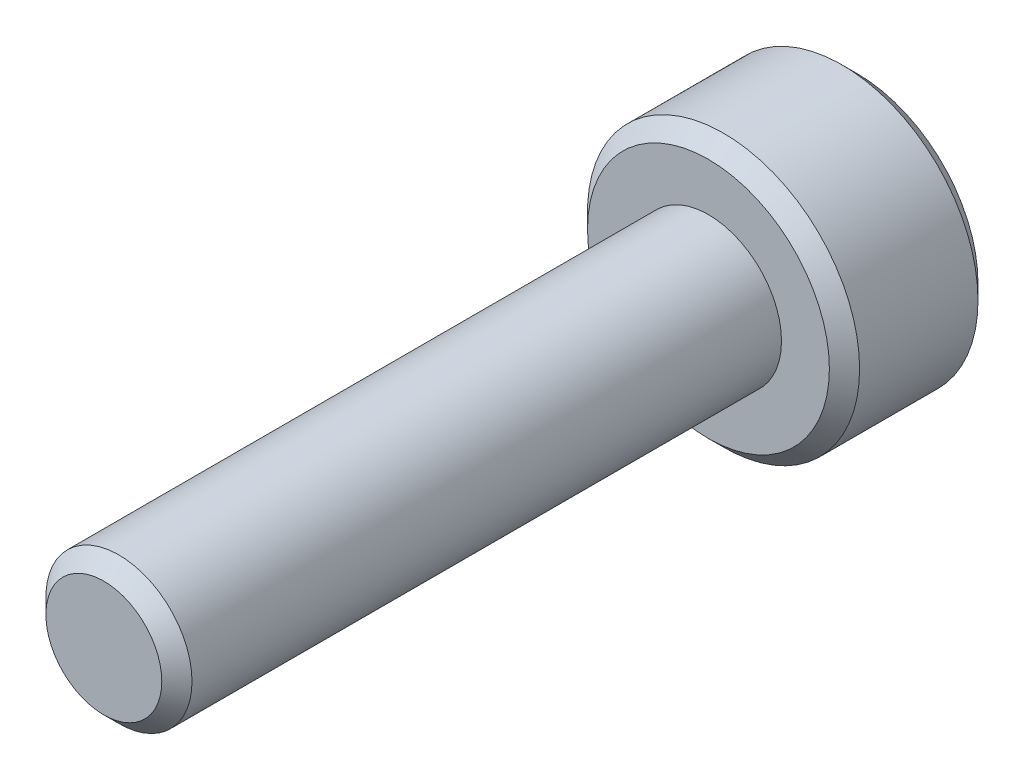
from build123d import *

# Parameters (mm, degrees)
SKIZZE1_R                       = 2.7
AUFSATZ_LINEAR_AUSTRAGEN1_DEPTH = 2.95
SKIZZE2_R                       = 1.45
AUFSATZ_LINEAR_AUSTRAGEN2_DEPTH = 12
FASE1_SIZE                      = 0.3
SCHNITT_LINEAR_AUSTRAGEN1_DEPTH = 2.5


with BuildPart() as part:
    # Skizze1 → Aufsatz-Linear austragen1 (new body)
    with BuildSketch(Plane.XY):
        Circle(SKIZZE1_R)
    extrude(amount=AUFSATZ_LINEAR_AUSTRAGEN1_DEPTH)

    # Skizze2 → Aufsatz-Linear austragen2 (add)
    with BuildSketch(Plane.XY.offset(2.95)):
        Circle(SKIZZE2_R)
    extrude(amount=AUFSATZ_LINEAR_AUSTRAGEN2_DEPTH)

    # Fase1
    fase1_edges = [part.edges().sort_by_distance(p)[0] for p in [
        (-2.7, 0, 2.95),
        (-2.7, 0, 0),
        (-1.45, 0, 14.95),
    ]]
    chamfer(fase1_edges, length=FASE1_SIZE)

    # Skizze3 → Schnitt-Linear austragen1 (cut)
    with BuildSketch(Plane(origin=(0, 0, 0), x_dir=(-1, 0, 0), z_dir=(0, 0, -1))):
        Polygon((1.25, 0.721687836), (0, 1.443375673), (-1.25, 0.721687836), (-1.25, -0.721687836), (0, -1.443375673), (1.25, -0.721687836), align=None)
    extrude(amount=-SCHNITT_LINEAR_AUSTRAGEN1_DEPTH, mode=Mode.SUBTRACT)


solid = part.part
